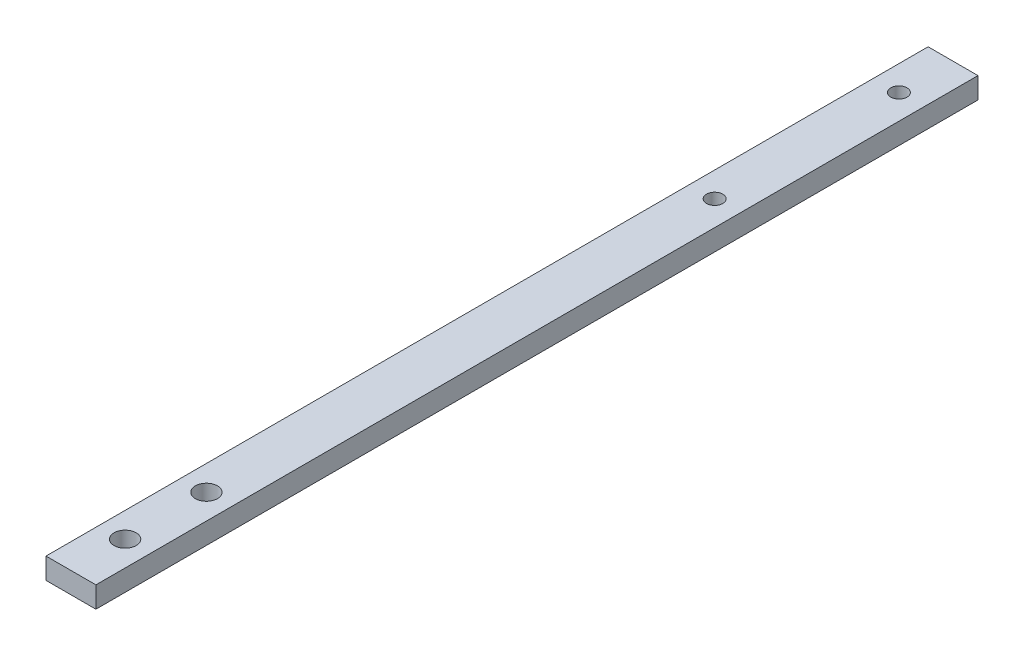
from build123d import *

# Parameters (mm, degrees)
SKETCH1_R               = 2.5
BOSS_EXTRUDE1_DEPTH     = 56
SKETCH2_W               = 4.604836256
SKETCH2_H               = 1.948199954
BOSS_EXTRUDE2_DEPTH     = 25.4
SKETCH3_R               = 1.022717979
CUT_EXTRUDE1_DEPTH      = 82.512449176
CUT_EXTRUDE2_DEPTH      = 82.476745149
CUT_EXTRUDE2_DEPTH_BACK = 82.476745149
SKETCH4_R               = 0.75
SKETCH5_OUTSIDE_W       = 23.342
SKETCH5_OUTSIDE_H       = 23.342
SKETCH5_OUTSIDE_W_2     = 4.604836256
SKETCH5_OUTSIDE_H_2     = 1.948199954
CUT_EXTRUDE3_DEPTH      = 82.476745255


with BuildPart() as part:
    # Sketch1 → Boss-Extrude1 (new body)
    with BuildSketch(Plane.XY):
        Circle(SKETCH1_R)
    extrude(amount=BOSS_EXTRUDE1_DEPTH)

    # Sketch2 → Boss-Extrude2 (add)
    with BuildSketch(Plane.XY.offset(56)):
        Rectangle(SKETCH2_W, SKETCH2_H)
    extrude(amount=BOSS_EXTRUDE2_DEPTH)

    # Sketch3 → Cut-Extrude1 (cut, through all)
    with BuildSketch(Plane(origin=(0, 0.974099977, 0), x_dir=(1, 0, 0), z_dir=(0, 1, 0))):
        with Locations((0, -68.9)):
            Circle(SKETCH3_R)
        with Locations((0, -76.4)):
            Circle(SKETCH3_R)
    extrude(amount=-CUT_EXTRUDE1_DEPTH, mode=Mode.SUBTRACT)

    # Sketch4 → Cut-Extrude2 (cut, two sides: drawn at the far end of the back side and taken through both)
    with BuildSketch(Plane(origin=(0, 0, 0), x_dir=(1, 0, 0), z_dir=(0, 1, 0)).offset(-CUT_EXTRUDE2_DEPTH_BACK)):
        with Locations((0, -5)):
            Circle(SKETCH4_R)
        with Locations((0, -22)):
            Circle(SKETCH4_R)
    extrude(amount=CUT_EXTRUDE2_DEPTH + CUT_EXTRUDE2_DEPTH_BACK, mode=Mode.SUBTRACT)

    # Sketch5 outside → Cut-Extrude3 (cut, through all)
    with BuildSketch(Plane.XY.offset(81.4)):
        Rectangle(SKETCH5_OUTSIDE_W, SKETCH5_OUTSIDE_H)
        Rectangle(SKETCH5_OUTSIDE_W_2, SKETCH5_OUTSIDE_H_2, mode=Mode.SUBTRACT)
    extrude(amount=-CUT_EXTRUDE3_DEPTH, mode=Mode.SUBTRACT)


solid = part.part
